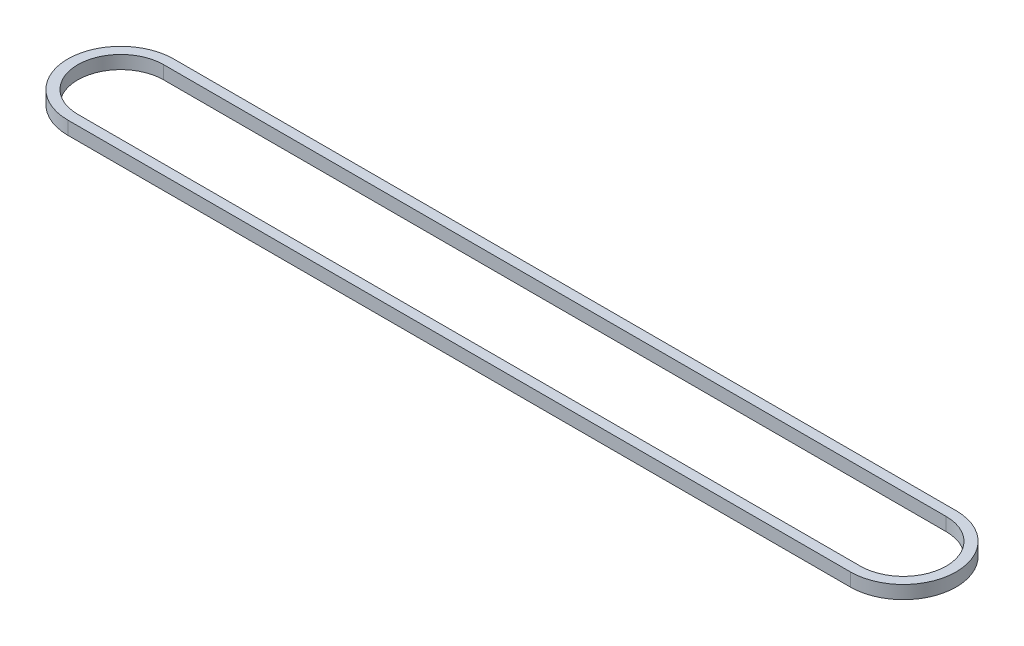
from build123d import *

# Parameters (mm, degrees)
BOSS_EXTRUDE1_DEPTH = 7.7978


with BuildPart() as part:
    # Sketch1 → Boss-Extrude1 (new body)
    with BuildSketch(Plane(origin=(0, 0, 0), x_dir=(1, 0, 0), z_dir=(0, 1, 0))):
        with BuildLine():
            Line((-231.25, 31.28695), (231.25, 31.28695))
            ThreePointArc((231.25, 31.28695), (262.53695, 0), (231.25, -31.28695))
            Line((231.25, -31.28695), (-231.25, -31.28695))
            ThreePointArc((-231.25, -31.28695), (-262.53695, 0), (-231.25, 31.28695))
        make_face()
        with BuildLine():
            Line((-231.25, 25.39415), (231.25, 25.39415))
            ThreePointArc((231.25, 25.39415), (256.64415, 0), (231.25, -25.39415))
            Line((231.25, -25.39415), (-231.25, -25.39415))
            ThreePointArc((-231.25, -25.39415), (-256.64415, 0), (-231.25, 25.39415))
        make_face(mode=Mode.SUBTRACT)
    extrude(amount=BOSS_EXTRUDE1_DEPTH)


solid = part.part
